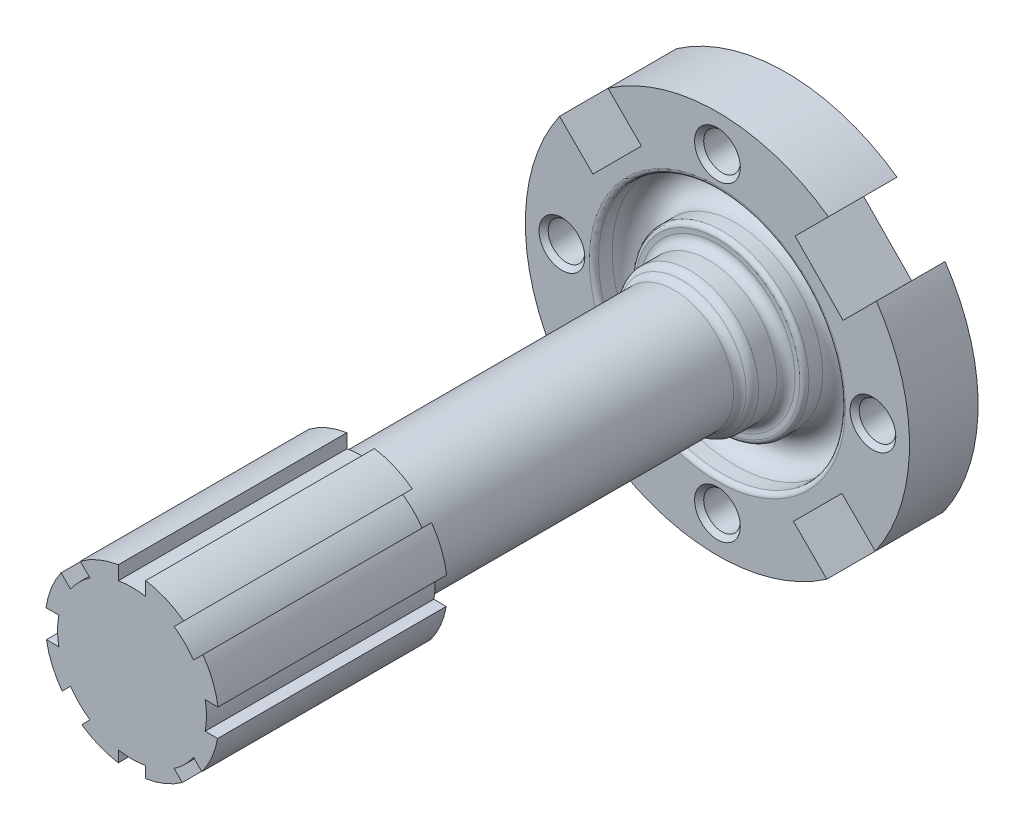
from build123d import *

# Parameters (mm, degrees)
F_8_0MM_DOWEL_HOLE1_D           = 8
F_8_0MM_DOWEL_HOLE1_CSINK_D     = 8.05
F_8_0MM_DOWEL_HOLE1_CSINK_ANGLE = 90
CUT_EXTRUDE1_DEPTH              = 62.26173357
CUT_EXTRUDE2_DEPTH              = 62.26173357
SKETCH12_R                      = 13
BOSS_EXTRUDE3_DEPTH             = 70
SKETCH16_R                      = 19
BOSS_EXTRUDE4_DEPTH             = 50
CUT_EXTRUDE5_START              = -50
CUT_EXTRUDE5_DEPTH              = 50
CIRPATTERN2_COUNT               = 8
FILLET1_R                       = 2
FILLET2_R                       = 2
FILLET3_R                       = 1
FILLET4_R                       = 1
CHAMFER2_SIZE                   = 1


with BuildPart() as part:
    # Sketch1 → Revolve1 (revolve)
    with BuildSketch(Plane(origin=(0, 0, 0), x_dir=(0, 0, -1), z_dir=(1, 0, 0)), mode=Mode.PRIVATE) as revolve1_sk:
        with BuildLine():
            Line((-23, 0), (-23, 15))
            Line((-23, 15), (-15, 15))
            Line((-15, 15), (-15, 19))
            Line((-15, 19), (-11, 19))
            ThreePointArc((-11, 19), (-7, 23), (-11, 27))
            Line((-11, 27), (-15, 27))
            Line((-15, 27), (-15, 42))
            Line((-15, 42), (0, 42))
            Line((0, 42), (0, 25.002045875))
            Line((0, 25.002045875), (-3.3, 25.002045875))
            Line((-3.3, 25.002045875), (-5.487395579, 0))
            Line((-5.487395579, 0), (-23, 0))
        make_face()
    revolve(revolve1_sk.sketch.rotate(Axis((0, 0, 23), (0, 0, -1)), 180), axis=Axis((0, 0, 23), (0, 0, -1)))

    # Ø8.0mm Dowel Hole1 (through all)
    with Locations(Plane.XY.offset(23)):
        with Locations((34, 0), (0, 34), (-34, 0), (0, -34)):
            CounterSinkHole(F_8_0MM_DOWEL_HOLE1_D / 2, F_8_0MM_DOWEL_HOLE1_CSINK_D / 2, counter_sink_angle=F_8_0MM_DOWEL_HOLE1_CSINK_ANGLE)

    # Sketch8 → Cut-Extrude1 (cut, symmetric)
    with BuildSketch(Plane.XY.offset(15)):
        Polygon((-184.432885046, 173.824482377), (-34.525177502, 23.916774834), (-27.224511551, 16.616108883), (-16.617054317, 27.223566117), (-23.917891868, 34.524403668), (-173.825599411, 184.432111212), (-473.645864656, 484.242676064), (-484.25315029, 473.63504723), align=None)
    cut_extrude1 = extrude(amount=CUT_EXTRUDE1_DEPTH, both=True, mode=Mode.SUBTRACT)

    # Mirror1: Cut-Extrude1 across plane
    add(cut_extrude1.mirror(Plane(origin=(0, 0, 0), x_dir=(0, 0, 1), z_dir=(-0.7071067811865487, 0.7071067811865464, 0))), mode=Mode.SUBTRACT)

    # Sketch9 → Cut-Extrude2 (cut, symmetric)
    with BuildSketch(Plane.XY.offset(15)):
        Polygon((174.24220549, 184.246397636), (24.272108184, 34.27630033), (16.974766202, 26.978958348), (27.470523572, 16.26497852), (34.768426829, 23.561759184), (184.750059076, 173.520320661), (487.756770128, 470.362321977), (477.248916541, 481.088398951), align=None)
    cut_extrude2 = extrude(amount=CUT_EXTRUDE2_DEPTH, both=True, mode=Mode.SUBTRACT)

    # Mirror4: Cut-Extrude2 across plane
    add(cut_extrude2.mirror(Plane(origin=(0, 0, 0), x_dir=(0, 0, 1), z_dir=(-0.7071067811865439, -0.7071067811865512, 0))), mode=Mode.SUBTRACT)

    # Sketch12 → Boss-Extrude3 (add)
    with BuildSketch(Plane.XY.offset(23)):
        Circle(SKETCH12_R)
    extrude(amount=BOSS_EXTRUDE3_DEPTH)

    # Sketch16 → Boss-Extrude4 (add)
    with BuildSketch(Plane.XY.offset(93)):
        with Locations(Location((0, 0, 0), (0, 0, 270))):
            Circle(SKETCH16_R)
    extrude(amount=BOSS_EXTRUDE4_DEPTH)

    # Sketch18 → Cut-Extrude5 (cut)
    with BuildSketch(Plane.XY.offset(143).offset(CUT_EXTRUDE5_START)):
        with BuildLine():
            ThreePointArc((3, 18.761663039), (0, 19), (-3, 18.761663039))
            Line((-3, 18.761663039), (-3, 15.716233646))
            ThreePointArc((-3, 15.716233646), (0, 16), (3, 15.716233646))
            Line((3, 15.716233646), (3, 18.761663039))
        make_face()
    cut_extrude5 = extrude(amount=CUT_EXTRUDE5_DEPTH, mode=Mode.SUBTRACT)

    # CirPattern2: Cut-Extrude5 ×8 about axis
    cirpattern2_axis = Axis((0, -0.282251763, 0), (0, 0, 1))
    for i in range(1, CIRPATTERN2_COUNT):
        add(cut_extrude5.rotate(cirpattern2_axis, i * 360 / CIRPATTERN2_COUNT), mode=Mode.SUBTRACT)

    # Fillet1
    fillet1_edges = [part.edges().sort_by_distance(p)[0] for p in [
        (0, 15, 15),
        (-13, 0, 93),
        (0, 15, 23),
    ]]
    fillet(fillet1_edges, radius=FILLET1_R - 0.0001)  # a hair under: the kernel refuses the full size

    # Fillet2
    fillet2_edges = [part.edges().sort_by_distance(p)[0] for p in [
        (-13, 0, 23),
    ]]
    fillet(fillet2_edges, radius=FILLET2_R)

    # Fillet3
    fillet3_edges = [part.edges().sort_by_distance(p)[0] for p in [
        (0, 19, 15),
    ]]
    fillet(fillet3_edges, radius=FILLET3_R)

    # Fillet4
    fillet4_edges = [part.edges().sort_by_distance(p)[0] for p in [
        (0, 27, 15),
    ]]
    fillet(fillet4_edges, radius=FILLET4_R)

    # Chamfer2
    chamfer2_edges = [part.edges().sort_by_distance(p)[0] for p in [
        (38, 0, 15),
        (4, -34, 15),
        (-30, 0, 15),
        (4, 34, 15),
    ]]
    chamfer(chamfer2_edges, length=CHAMFER2_SIZE)


solid = part.part
